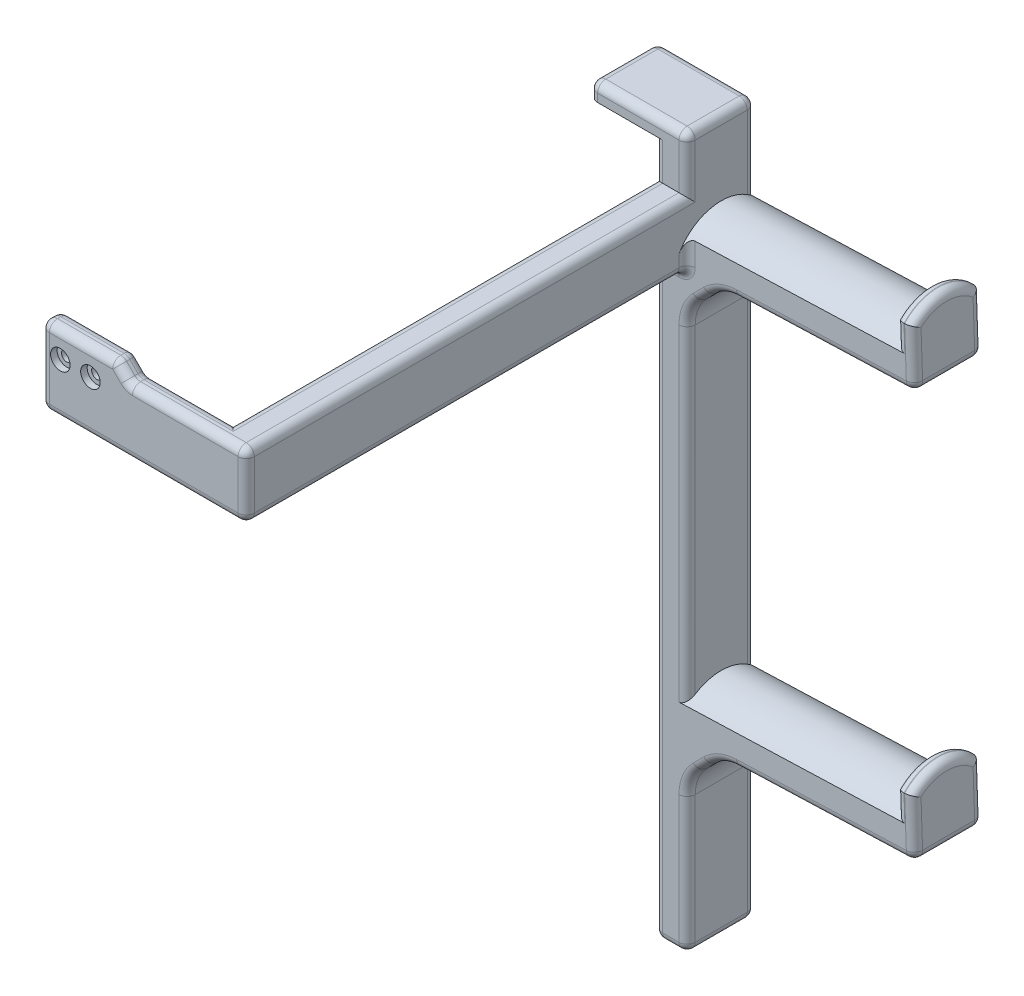
from build123d import *

# Parameters (mm, degrees)
SKETCH2_W                = 21
SKETCH2_H                = 24
SKETCH2_R                = 1.625
BOSS_EXTRUDE1_DEPTH      = 6
SKETCH4_W                = 32
SKETCH4_H                = 20
BOSS_EXTRUDE3_DEPTH      = 6
BOSS_EXTRUDE4_DEPTH      = 10
BOSS_EXTRUDE7_DEPTH      = 11.5
BOSS_EXTRUDE7_DEPTH_BACK = 202
SKETCH9_W                = 10
SKETCH9_H                = 21
BOSS_EXTRUDE9_DEPTH      = 70
BOSS_EXTRUDE6_DEPTH      = 5.2
LPATTERN1_COUNT          = 2
LPATTERN1_PITCH          = 125
SKETCH10_W               = 30
SKETCH10_H               = 21
BOSS_EXTRUDE8_DEPTH      = 5
CHAMFER1_SIZE            = 6
CHAMFER2_SIZE            = 10
CHAMFER2_SIZE_2          = 10.368159553
FILLET2_R                = 12.5
FILLET1_R                = 2.5
SKETCH12_R               = 3
CUT_EXTRUDE2_DEPTH       = 2


# Some blends are built 0.0001 mm under size
with BuildPart() as part:
    # Sketch2 → Boss-Extrude1 (new body)
    with BuildSketch(Plane.XY):
        with Locations((0, -4)):
            Rectangle(SKETCH2_W, SKETCH2_H)
        with Locations((-4.625, 0)):
            Circle(SKETCH2_R, mode=Mode.SUBTRACT)
        with Locations((4.625, 0)):
            Circle(SKETCH2_R, mode=Mode.SUBTRACT)
    extrude(amount=-BOSS_EXTRUDE1_DEPTH)

    # Sketch4 → Boss-Extrude3 (add)
    with BuildSketch(Plane.XY):
        with Locations((26.5, -6)):
            Rectangle(SKETCH4_W, SKETCH4_H)
    extrude(amount=-BOSS_EXTRUDE3_DEPTH)

    # Sketch5 → Boss-Extrude4 (add)
    with BuildSketch(Plane(origin=(42.5, 0, 0), x_dir=(0, 0, -1), z_dir=(1, 0, 0))):
        Polygon((0, 4), (146, 4), (156.5, 4), (156.5, -16), (146, -16), (0, -16), align=None)
    extrude(amount=BOSS_EXTRUDE4_DEPTH)

    # Sketch9 → Boss-Extrude7 (add, two sides: drawn at the far end of the back side and taken through both)
    with BuildSketch(Plane(origin=(0, 4, 0), x_dir=(1, 0, 0), z_dir=(0, 1, 0)).offset(-BOSS_EXTRUDE7_DEPTH_BACK)):
        with Locations((47.5, 146)):
            Rectangle(SKETCH9_W, SKETCH9_H)
    extrude(amount=BOSS_EXTRUDE7_DEPTH + BOSS_EXTRUDE7_DEPTH_BACK)

    # Sketch7 → Boss-Extrude9 (add)
    with BuildSketch(Plane(origin=(51.969477448, -0.807821843, 0), x_dir=(0, 0, -1), z_dir=(0.9993908270190962, 0.03489949670248751, 0))):
        with BuildLine():
            Line((156.5, -15.201438463), (135.5, -15.201438463))
            Line((135.5, -15.201438463), (135.5, -5.701438463))
            ThreePointArc((135.5, -5.701438463), (146, -1.352196058), (156.5, -5.701438463))
            Line((156.5, -5.701438463), (156.5, -15.201438463))
        make_face()
    boss_extrude9 = extrude(amount=BOSS_EXTRUDE9_DEPTH)

    # Sketch8 → Boss-Extrude6 (add)
    with BuildSketch(Plane(origin=(121.911720419, 2.067977625, 0), x_dir=(0, 0, -1), z_dir=(0.9993908270190963, 0.034899496702487515, 0))):
        with BuildLine():
            Line((156.5, -15.634536993), (135.5, -15.634536993))
            Line((135.5, -15.634536993), (135.5, 1.865463007))
            ThreePointArc((135.5, 1.865463007), (146, 6.214705412), (156.5, 1.865463007))
            Line((156.5, 1.865463007), (156.5, -15.634536993))
        make_face()
    boss_extrude6 = extrude(amount=-BOSS_EXTRUDE6_DEPTH)

    # LPattern1: Boss-Extrude9, Boss-Extrude6 ×2
    with Locations(*[(0, -i * LPATTERN1_PITCH, 0) for i in range(1, LPATTERN1_COUNT)]):
        add(boss_extrude9)
        add(boss_extrude6)

    # Sketch10 → Boss-Extrude8 (add)
    with BuildSketch(Plane(origin=(0, 15.5, 0), x_dir=(1, 0, 0), z_dir=(0, 1, 0))):
        with Locations((37.5, 146)):
            Rectangle(SKETCH10_W, SKETCH10_H)
    extrude(amount=BOSS_EXTRUDE8_DEPTH)

    # Chamfer1
    # the kernel refuses this chamfer: 6 mm, written as the material it adds along each edge
    with BuildSketch(Plane(origin=(10.5, 4, 0), x_dir=(0, 1, 0), z_dir=(0, 0, -1))) as chamfer1_piece_1_section:
        Polygon((CHAMFER1_SIZE, 0), (0, CHAMFER1_SIZE), (0, 0), align=None)
    chamfer1_piece_1 = extrude(amount=6, mode=Mode.PRIVATE)
    chamfer1_piece_1 = split(chamfer1_piece_1, bisect_by=Plane(origin=(10.5, 8, 0), z_dir=(0, -1, 0)), keep=Keep.TOP, mode=Mode.PRIVATE)
    add(chamfer1_piece_1)

    # Chamfer2
    # the kernel refuses this chamfer: 10.368159553, 10 mm, written as the material it adds along each edge
    with BuildSketch(Plane(origin=(52.5, -141, -156.5), x_dir=(0, -1, 0), z_dir=(0, 0, 1)), Plane(origin=(52.5, -16, -156.5), x_dir=(0, -1, 0), z_dir=(0, 0, 1))) as chamfer2_piece_1:
        Polygon((CHAMFER2_SIZE, 0), (-CHAMFER2_SIZE_2 * 0.0348994967018, CHAMFER2_SIZE_2 * 0.999390826998), (0, 0), align=None)
    extrude(amount=21)

    # Fillet2
    fillet2_edges = [part.edges().sort_by_distance(p)[0] for p in [
        (62.86184355, -140.63815645, -146),
        (52.5, -151, -146),
        (62.86184355, -15.63815645, -146),
        (52.5, -26, -146),
    ]]
    fillet(fillet2_edges, radius=FILLET2_R)

    # Fillet1
    fillet1_edges = [part.edges().sort_by_distance(p)[0] for p in [
        (52.5, -81.335939429, -135.5),
        (52.5, -81.335939429, -156.5),
        (95.120041446, -139.511675357, -156.5),
        (95.120041446, -139.511675357, -135.5),
        (122.151987295, -129.812365494, -156.5),
        (122.151987295, -129.812365494, -135.5),
        (122.457357891, -138.557035231, -146),
        (-10.5, -4, -6),
        (121.694830328, -116.721102794, -146),
        (116.789382385, -125.246736449, -156.5),
        (116.789382385, -125.246736449, -135.5),
        (116.497998028, -116.902580177, -146),
        (22.5, 18, -156.5),
        (22.5, 18, -135.5),
        (52.5, 20.5, -146),
        (37.5, 20.5, -156.5),
        (22.5, 20.5, -146),
        (37.5, 20.5, -135.5),
        (16.5, 4, -3),
        (14.5, 6, 0),
        (16, -16, -6),
        (12.5, 8, -3),
        (14.5, 6, -6),
        (57.77064959, -145.72935041, -135.5),
        (57.77064959, -145.72935041, -156.5),
        (57.77064959, -20.72935041, -135.5),
        (57.77064959, -20.72935041, -156.5),
        (53.451505844, -151.394126625, -135.5),
        (53.451505844, -151.394126625, -156.5),
        (63.234605347, -141.495449891, -156.5),
        (63.234605347, -141.495449891, -135.5),
        (53.451505844, -26.394126625, -135.5),
        (53.451505844, -26.394126625, -156.5),
        (63.234605347, -16.495449891, -156.5),
        (63.234605347, -16.495449891, -135.5),
        (34.5, 4, 0),
        (29.5, 4, -6),
        (42.5, -16, -70.75),
        (42.5, -91.25, -156.5),
        (52.5, -6, 0),
        (52.5, -16, -67.75),
        (52.5, -177.088834765, -156.5),
        (21, -16, 0),
        (52.5, 4, -67.75),
        (42.5, 4, -70.75),
        (-10.5, -4, 0),
        (52.5, -198, -146),
        (42.5, -107, -135.5),
        (42.5, -198, -146),
        (52.5, -177.088834765, -135.5),
        (47.5, -16, -135.5),
        (47.5, -198, -135.5),
        (47.5, -198, -156.5),
        (1, 8, 0),
        (52.5, 12.25, -135.5),
        (42.5, 9.75, -135.5),
        (52.5, 7.002895335, -156.5),
        (52.5, -11.247104665, -135.5),
        (-10.5, -16, -3),
        (95.120041446, -14.511675357, -156.5),
        (95.120041446, -14.511675357, -135.5),
        (122.151987295, -4.812365494, -156.5),
        (-10.5, 8, -3),
        (122.151987295, -4.812365494, -135.5),
        (122.457357891, -13.557035231, -146),
        (1, 8, -6),
        (121.694830328, 8.278897206, -146),
        (116.789382385, -0.246736449, -156.5),
        (116.789382385, -0.246736449, -135.5),
        (116.497998028, 8.097419823, -146),
    ]]
    fillet(fillet1_edges, radius=FILLET1_R - 0.0001)  # a hair under: the kernel refuses the full size

    # Sketch12 → Cut-Extrude2 (cut)
    with BuildSketch(Plane.XY):
        with Locations((-4.625, 0)):
            Circle(SKETCH12_R)
        with Locations((4.625, 0)):
            Circle(SKETCH12_R)
    extrude(amount=-CUT_EXTRUDE2_DEPTH, mode=Mode.SUBTRACT)


solid = part.part
